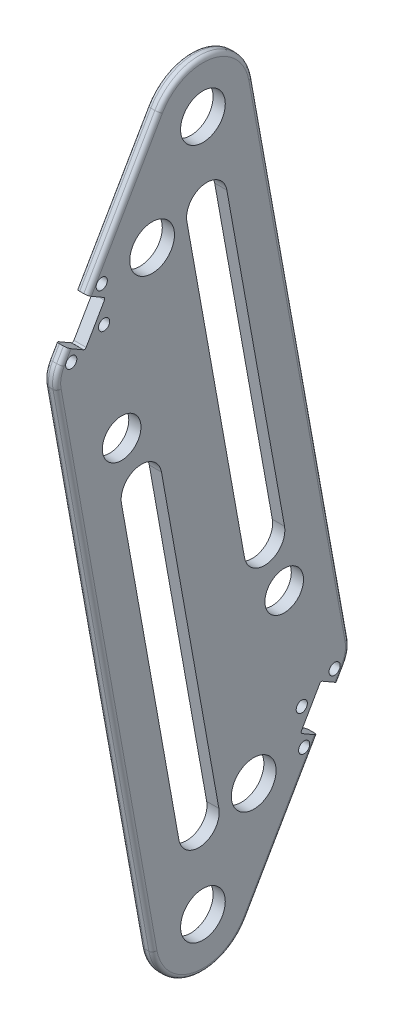
from build123d import *

# Parameters (mm, degrees)
SKETCH_2_R          = 9.5
SKETCH_2_R_2        = 11
EXTRUDE_1_DEPTH     = 6
CUT_EXTRUDE_1_DEPTH = 10
FILLET_1_R          = 25
SKETCH_4_R          = 2.75
CUT_EXTRUDE_2_DEPTH = 10
FILLET_2_R          = 15
FILLET_3_R          = 1
FILLET_4_R          = 2


with BuildPart() as part:
    # 草图2 → 凸台-拉伸1 (new body)
    with BuildSketch(Plane(origin=(0, 0, 0), x_dir=(0, 0, -1), z_dir=(1, 0, 0))):
        Polygon((12.494318662, 71.640794729), (-72.751567756, -76.009411684), (-12.535755442, -411.712565336), (72.916857811, -263.704297543), align=None)
        with Locations((-40, -117)):
            Circle(SKETCH_2_R, mode=Mode.SUBTRACT)
        with Locations((25, -296.698729811)):
            Circle(SKETCH_2_R_2, mode=Mode.SUBTRACT)
        with Locations((0, -340)):
            Circle(SKETCH_2_R_2, mode=Mode.SUBTRACT)
        with Locations((-25, -43.301270189)):
            Circle(SKETCH_2_R_2, mode=Mode.SUBTRACT)
        with Locations((40, -222)):
            Circle(SKETCH_2_R, mode=Mode.SUBTRACT)
        Circle(SKETCH_2_R_2, mode=Mode.SUBTRACT)
    extrude(amount=EXTRUDE_1_DEPTH)

    # 草图3 → 切除-拉伸1 (cut)
    with BuildSketch(Plane(origin=(6, 0, 0), x_dir=(0, 0, -1), z_dir=(1, 0, 0))):
        with BuildLine():
            Line((-20.40575236, -141.278289439), (7.842954525, -298.764830322))
            ThreePointArc((7.842954525, -298.764830322), (-0.2344101, -310.373283308), (-11.842863085, -302.295918683))
            Line((-11.842863085, -302.295918683), (-40.09156997, -144.8093778))
            ThreePointArc((-40.09156997, -144.8093778), (-32.014205345, -133.200924814), (-20.40575236, -141.278289439))
        make_face()
        with BuildLine():
            Line((11.783440235, -37.201240644), (40.155401092, -194.665623401))
            ThreePointArc((40.155401092, -194.665623401), (32.087124724, -206.280394877), (20.472353248, -198.212118508))
            Line((20.472353248, -198.212118508), (-7.89960761, -40.747735751))
            ThreePointArc((-7.89960761, -40.747735751), (0.168668759, -29.132964275), (11.783440235, -37.201240644))
        make_face()
    extrude(amount=-CUT_EXTRUDE_1_DEPTH, mode=Mode.SUBTRACT)

    # 圆角1
    fillet_1_edges = [part.edges().sort_by_distance(p)[0] for p in [
        (3, -411.712565336, 12.535755442),
        (3, 71.640794729, -12.494318662),
    ]]
    fillet(fillet_1_edges, radius=FILLET_1_R)

    # 草图4 → 切除-拉伸2 (cut)
    with BuildSketch(Plane(origin=(6, 0, 0), x_dir=(0, 0, -1), z_dir=(1, 0, 0))):
        with Locations((-49.820508076, -46.291651246)):
            Circle(SKETCH_4_R)
        with Locations((-64.820508076, -72.27241336)):
            Circle(SKETCH_4_R)
        with Locations((-48.660254038, -64.282032303)):
            Circle(SKETCH_4_R)
        with Locations((48.660254038, -275.717967697)):
            Circle(SKETCH_4_R)
        with Locations((49.820508076, -293.708348754)):
            Circle(SKETCH_4_R)
        with Locations((64.820508076, -267.72758664)):
            Circle(SKETCH_4_R)
        Polygon((-66.650635095, -65.442286341), (-56.650635095, -48.121778265), (-47.990381057, -53.121778265), (-57.990381057, -70.442286341), align=None)
        Polygon((47.990381057, -286.878221735), (57.990381057, -269.557713659), (66.650635095, -274.557713659), (56.650635095, -291.878221735), align=None)
    extrude(amount=-CUT_EXTRUDE_2_DEPTH, mode=Mode.SUBTRACT)

    # 圆角2
    fillet_2_edges = [part.edges().sort_by_distance(p)[0] for p in [
        (3, -76.009411684, 72.751567756),
        (3, -263.704297543, -72.916857811),
    ]]
    fillet(fillet_2_edges, radius=FILLET_2_R)

    # 圆角3
    fillet_3_edges = [part.edges().sort_by_distance(p)[0] for p in [
        (3, -70.442286341, 57.990381057),
        (3, -53.121778265, 47.990381057),
        (3, -286.878221735, -47.990381057),
        (3, -269.557713659, -57.990381057),
    ]]
    fillet(fillet_3_edges, radius=FILLET_3_R)

    # 圆角4
    fillet_4_edges = [part.edges().sort_by_distance(p)[0] for p in [
        (6, -68.350930797, 68.329941754),
        (6, -76.176657925, 71.794811932),
        (6, -212.910875987, 48.195251289),
        (6, -364.626574291, 4.304862213),
        (0, -68.350930797, 68.329941754),
        (0, -76.176657925, 71.794811932),
        (0, -212.910875987, 48.195251289),
        (0, -364.626574291, 4.304862213),
        (0, -271.508805911, -68.410922804),
        (0, -263.537032824, -71.957783708),
        (0, -17.810889132, 39.150635095),
        (0, 24.628257085, -4.295224436),
        (6, -271.508805911, -68.410922804),
        (6, -263.537032824, -71.957783708),
        (6, -17.810889132, 39.150635095),
        (6, 24.628257085, -4.295224436),
        (6, -322.189110868, -39.150635095),
        (0, -322.189110868, -39.150635095),
        (0, -126.933453974, -48.273462573),
        (6, -126.933453974, -48.273462573),
    ]]
    fillet(fillet_4_edges, radius=FILLET_4_R)


solid = part.part
